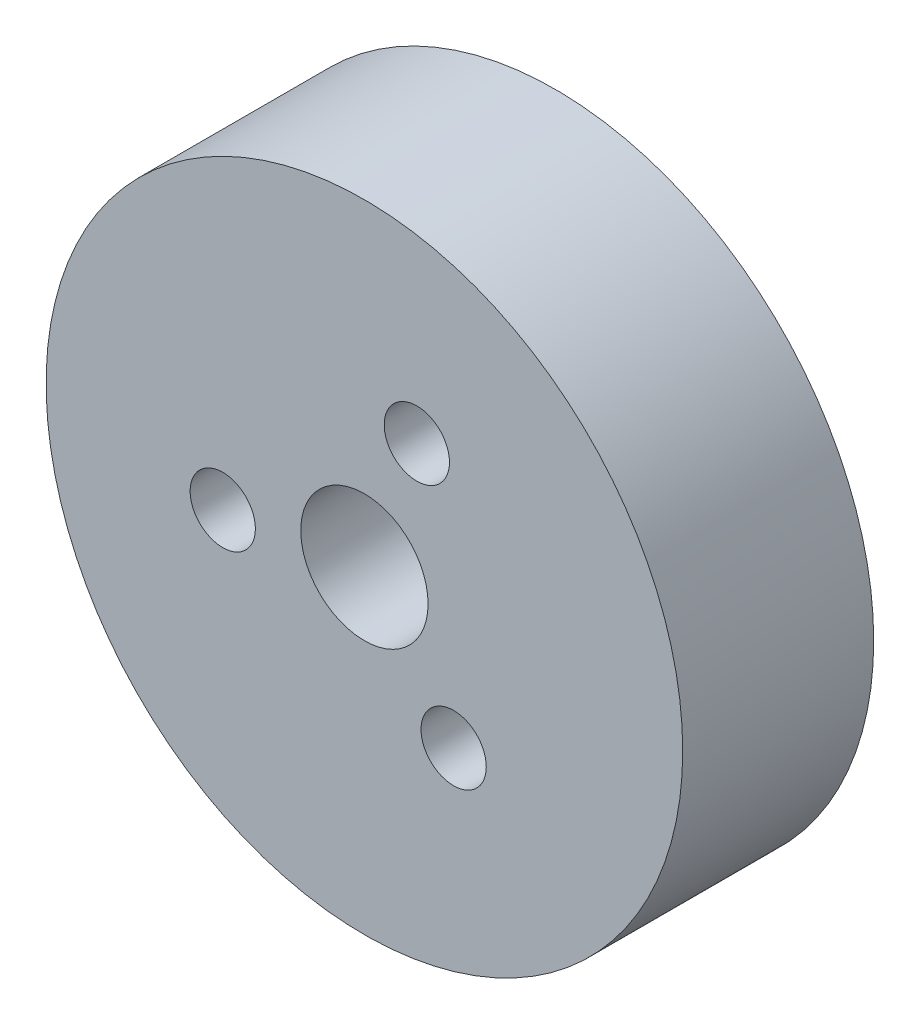
from build123d import *

# Parameters (mm, degrees)
SKETCH1_R                    = 10
SKETCH1_R_2                  = 2
BOSS_EXTRUDE1_DEPTH          = 6
F_2_05_2_05_DIAMETER_HOLE1_D = 2.05


with BuildPart() as part:
    # Sketch1 → Boss-Extrude1 (new body)
    with BuildSketch(Plane.XY):
        Circle(SKETCH1_R)
        Circle(SKETCH1_R_2, mode=Mode.SUBTRACT)
    extrude(amount=BOSS_EXTRUDE1_DEPTH)

    # Ø2.05 (2.05) Diameter Hole1 (through all)
    with Locations(Plane(origin=(-166.219089549, 17.54789674, 8.795501481), x_dir=(0.06288111672161824, -0.9980210244077238, 0), z_dir=(0, 0, 1))):
        with Locations((23.889274715, 166.693737615), (31.654710724, 167.363068324), (28.351650117, 160.303338115)):
            Hole(F_2_05_2_05_DIAMETER_HOLE1_D / 2)


solid = part.part
